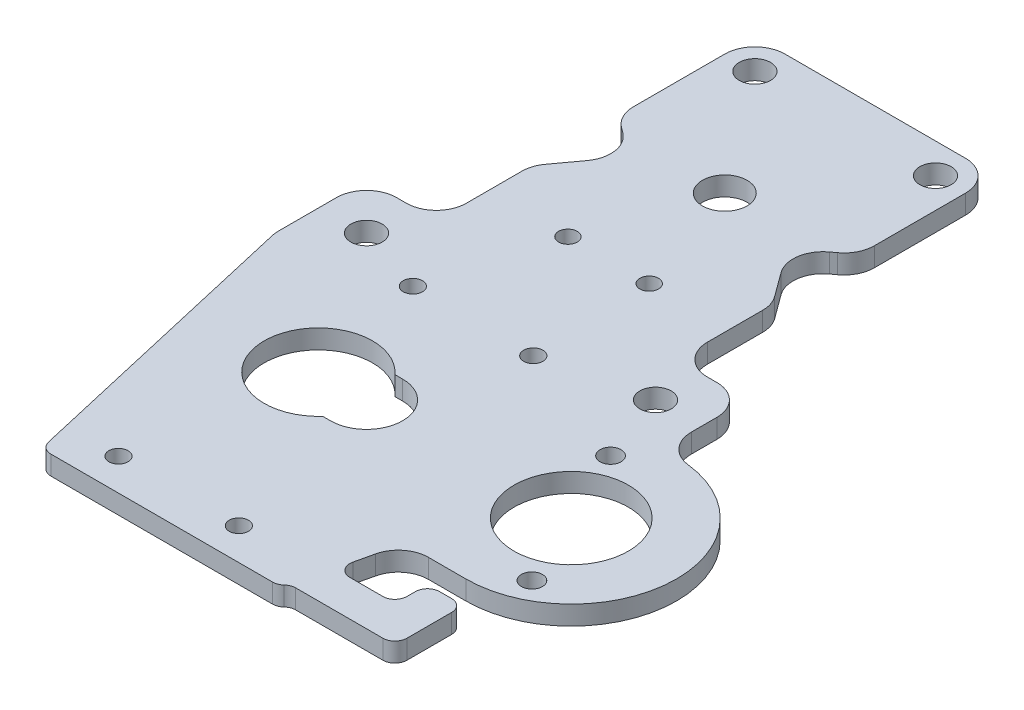
from build123d import *

# Parameters (mm, degrees)
SKETCH1_R           = 9.5
SKETCH1_R_2         = 1.75
SKETCH1_R_3         = 2.6
SKETCH1_R_4         = 3.7
SKETCH1_R_5         = 1.6
SKETCH1_R_6         = 1.55
BOSS_EXTRUDE1_DEPTH = 3.175
FILLET1_R           = 5
FILLET2_R           = 2
BOSS_EXTRUDE2_DEPTH = 3.175
FILLET3_R           = 2
FILLET4_R           = 2
BOSS_EXTRUDE3_START = -3.175
SKETCH4_R           = 2.6
BOSS_EXTRUDE3_DEPTH = 3.175
FILLET5_R           = 5


with BuildPart() as part:
    # Sketch1 → Boss-Extrude1 (new body)
    with BuildSketch(Plane(origin=(0, 0, 0), x_dir=(1, 0, 0), z_dir=(0, 1, 0))):
        with BuildLine():
            Line((-20, -12.068401935), (-7.259795863, 5.319338683))
            ThreePointArc((-7.259795863, 5.319338683), (0, 9), (7.259795863, 5.319338683))
            Line((7.259795863, 5.319338683), (20, -12.068401935))
            Line((20, -12.068401935), (20, -27.9))
            Line((20, -27.9), (31.6, -27.9))
            Line((31.6, -27.9), (31.6, -42.165352614))
            ThreePointArc((31.6, -42.165352614), (51.458612907, -58.2971553), (34, -77))
            Line((34, -77), (23.797619048, -77))
            Line((23.797619048, -77), (20, -93.5))
            Line((20, -93.5), (-20, -93.5))
            Line((-20, -93.5), (-31.6, -43.1))
            Line((-31.6, -43.1), (-31.6, -27.9))
            Line((-31.6, -27.9), (-20, -27.9))
            Line((-20, -27.9), (-20, -12.068401935))
        make_face()
        with Locations(Location((34, -59.5, 0), (0, 0, 270))):
            Circle(SKETCH1_R, mode=Mode.SUBTRACT)
        with Locations(Location((28.294653467, -47.264844875, 0), (0, 0, 270))):
            Circle(SKETCH1_R_2, mode=Mode.SUBTRACT)
        with Locations(Location((39.705346533, -71.735155125, 0), (0, 0, 270))):
            Circle(SKETCH1_R_2, mode=Mode.SUBTRACT)
        with Locations(Location((-24, -35.5, 0), (0, 0, 270))):
            Circle(SKETCH1_R_3, mode=Mode.SUBTRACT)
        with Locations(Location((24, -35.5, 0), (0, 0, 270))):
            Circle(SKETCH1_R_3, mode=Mode.SUBTRACT)
        with Locations(Location((0, 0, 0), (0, 0, 270))):
            Circle(SKETCH1_R_4, mode=Mode.SUBTRACT)
        with Locations(Location((-12.5, -39.3, 0), (0, 0, 270))):
            Circle(SKETCH1_R_5, mode=Mode.SUBTRACT)
        with Locations(Location((-6.75, -19.3, 0), (0, 0, 270))):
            Circle(SKETCH1_R_6, mode=Mode.SUBTRACT)
        with Locations(Location((6.75, -19.3, 0), (0, 0, 270))):
            Circle(SKETCH1_R_6, mode=Mode.SUBTRACT)
        with Locations(Location((7.5, -39.3, 0), (0, 0, 90))):
            Circle(SKETCH1_R_5, mode=Mode.SUBTRACT)
        with Locations(Location((7.5, -88.2, 0), (0, 0, 270))):
            Circle(SKETCH1_R_5, mode=Mode.SUBTRACT)
        with Locations(Location((-12.5, -88.2, 0), (0, 0, 90))):
            Circle(SKETCH1_R_5, mode=Mode.SUBTRACT)
        with BuildLine():
            Line((0, -53.5), (-1.291796068, -53.5))
            ThreePointArc((-1.291796068, -53.5), (-17, -59.5), (-1.291796068, -65.5))
            Line((-1.291796068, -65.5), (0, -65.5))
            ThreePointArc((0, -65.5), (6, -59.5), (0, -53.5))
        make_face(mode=Mode.SUBTRACT)
    extrude(amount=BOSS_EXTRUDE1_DEPTH)

    # Fillet1
    fillet1_edges = [part.edges().sort_by_distance(p)[0] for p in [
        (-31.6, 1.5875, 43.1),
        (-31.6, 1.5875, 27.9),
        (-20, 1.5875, 27.9),
        (-20, 1.5875, 12.068401935),
        (20, 1.5875, 12.068401935),
        (20, 1.5875, 27.9),
        (31.6, 1.5875, 27.9),
        (31.6, 1.5875, 42.165352614),
        (23.797619048, 1.5875, 77),
    ]]
    fillet(fillet1_edges, radius=FILLET1_R)

    # Fillet2
    fillet2_edges = [part.edges().sort_by_distance(p)[0] for p in [
        (-20, 1.5875, 93.5),
        (20, 1.5875, 93.5),
    ]]
    fillet(fillet2_edges, radius=FILLET2_R)

    # Sketch3 → Boss-Extrude2 (add)
    with BuildSketch(Plane(origin=(0, 3.175, 0), x_dir=(1, 0, 0), z_dir=(0, 1, 0))):
        Polygon((21.631006471, -86.413558093), (31.631006471, -86.413558093), (31.631006471, -81), (37.631006471, -81), (37.631006471, -92.413558093), (20.25005409, -92.413558093), align=None)
    extrude(amount=-BOSS_EXTRUDE2_DEPTH)

    # Fillet3
    fillet3_edges = [part.edges().sort_by_distance(p)[0] for p in [
        (21.631006471, 1.5875, 86.413558093),
        (31.631006471, 1.5875, 86.413558093),
        (31.631006471, 1.5875, 81),
        (37.631006471, 1.5875, 81),
        (37.631006471, 1.5875, 92.413558093),
    ]]
    fillet(fillet3_edges, radius=FILLET3_R)

    # Fillet4
    # the kernel refuses this fillet: 2 mm, written as the material it adds along each edge
    with BuildSketch(Plane(origin=(20.357070738, 0, 91.948589209), x_dir=(-0.22429460454884337, 0, 0.974521385281143), z_dir=(0, 1, 0))) as fillet4_piece_1:
        with BuildLine():
            CenterArc((1.551860901, 1.686696047), FILLET4_R, 237.495369906, 9.676681216)
            ThreePointArc((0.77593045, -0.156651976), (0.395792845, -0.039554126), (0, 0))
            Line((0, 0), (0.477125378, 0))
        make_face()
    extrude(amount=3.175)
    # the kernel refuses this fillet: 2 mm, written as the material it adds along each edge
    with BuildSketch(Plane(origin=(20.25005409, 3.175, 92.413558093), x_dir=(1, 0, 0), z_dir=(0, -1, 0))) as fillet4_2_piece_1:
        with BuildLine():
            CenterArc((0.898626945, 2), FILLET4_R, 226.75155148, 43.24844852)
            Line((-0.471699589, 0.543220953), (-0.608732242, 0.397543049))
            ThreePointArc((-0.608732242, 0.397543049), (-0.381915572, 0.139094357), (-0.140266399, -0.142566957))
            Line((-0.140266399, -0.142566957), (0, -0.2))
            Line((0, -0.2), (0.898626945, -0.2))
            Line((0.898626945, -0.2), (0.898626945, 0))
        make_face()
    extrude(amount=3.175)

    # Sketch4 → Boss-Extrude3 (add)
    with BuildSketch(Plane(origin=(0, 3.175, 0), x_dir=(1, 0, 0), z_dir=(0, 1, 0)).offset(BOSS_EXTRUDE3_START)):
        with BuildLine():
            Line((13.146507893, -2.714804316), (7.259795863, 5.319338683))
            ThreePointArc((7.259795863, 5.319338683), (0, 9), (-7.259795863, 5.319338683))
            Line((-7.259795863, 5.319338683), (-13.146507893, -2.714804316))
            Line((-13.146507893, -2.714804316), (-20, 2.306830778))
            Line((-20, 2.306830778), (-20, 25))
            Line((-20, 25), (20, 25))
            Line((20, 25), (20, 2.306830778))
            Line((20, 2.306830778), (13.146507893, -2.714804316))
        make_face()
        with Locations(Location((-15, 20, 0), (0, 0, 270))):
            Circle(SKETCH4_R, mode=Mode.SUBTRACT)
        with Locations(Location((15, 20, 0), (0, 0, 270))):
            Circle(SKETCH4_R, mode=Mode.SUBTRACT)
    extrude(amount=BOSS_EXTRUDE3_DEPTH)

    # Fillet5
    fillet5_edges = [part.edges().sort_by_distance(p)[0] for p in [
        (13.146507893, 1.5875, 2.714804316),
        (20, 1.5875, -2.306830778),
        (20, 1.5875, -25),
        (-20, 1.5875, -25),
        (-20, 1.5875, -2.306830778),
        (-13.146507893, 1.5875, 2.714804316),
    ]]
    fillet(fillet5_edges, radius=FILLET5_R)


solid = part.part
